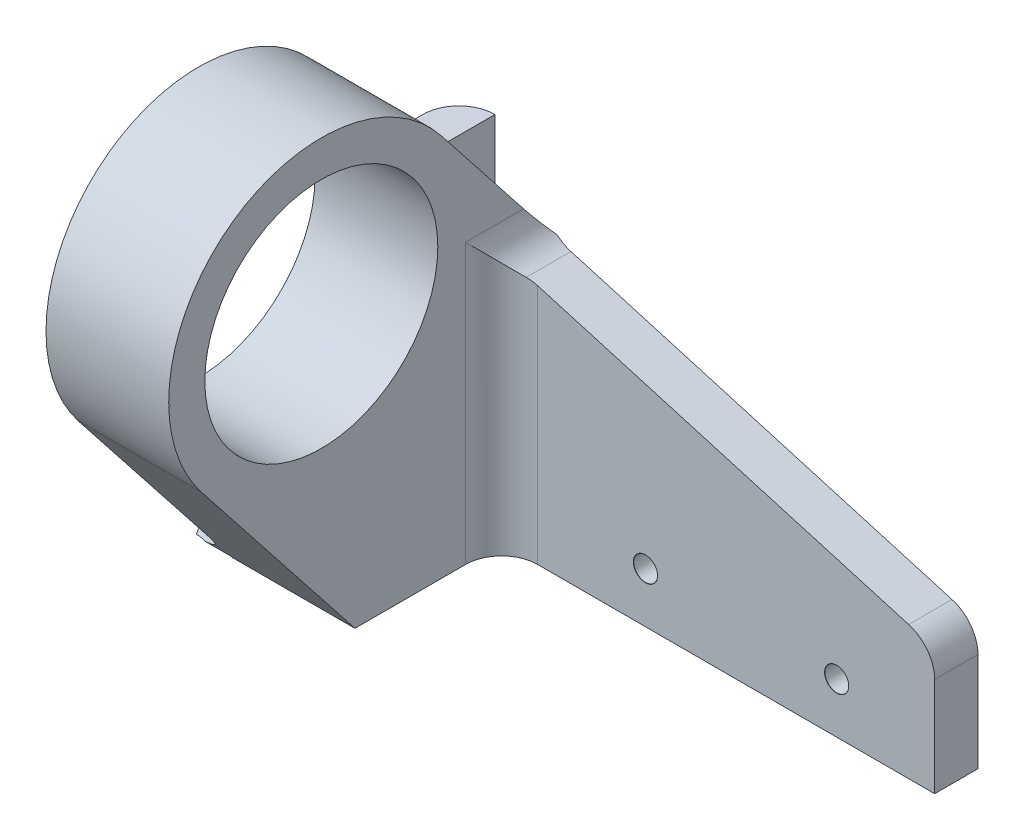
from build123d import *

# Parameters (mm, degrees)
SKETCH1_R                             = 21.14
SKETCH1_R_2                           = 16.14
BOSS_EXTRUDE1_DEPTH                   = 17
BOSS_EXTRUDE2_DEPTH                   = 17
SKETCH3_W                             = 6
SKETCH3_H                             = 34.909785338
BOSS_EXTRUDE3_DEPTH                   = 60
CUT_EXTRUDE1_DEPTH                    = 30
FILLET1_R                             = 5
BOSS_EXTRUDE4_DEPTH                   = 5
FILLET2_R                             = 5
TAP_DRILL_FOR_M4X0_7_TAP1_D           = 3.3
TAP_DRILL_FOR_M4X0_7_TAP1_DEPTH       = 5
TAP_DRILL_FOR_M4X0_7_TAP1_CSINK_D     = 3.35
TAP_DRILL_FOR_M4X0_7_TAP1_CSINK_ANGLE = 100
TAP_DRILL_FOR_M4X0_7_TAP1_TIP         = 0.991420021
TAP_DRILL_FOR_M4X0_7_TAP2_D           = 3.3
TAP_DRILL_FOR_M4X0_7_TAP2_DEPTH       = 7
TAP_DRILL_FOR_M4X0_7_TAP2_CSINK_D     = 3.35
TAP_DRILL_FOR_M4X0_7_TAP2_CSINK_ANGLE = 100
TAP_DRILL_FOR_M4X0_7_TAP2_TIP         = 0.991420021


with BuildPart() as part:
    # Sketch1 → Boss-Extrude1 (new body)
    with BuildSketch(Plane(origin=(0, 0, 0), x_dir=(0, 0, -1), z_dir=(1, 0, 0))):
        Circle(SKETCH1_R)
        Circle(SKETCH1_R_2, mode=Mode.SUBTRACT)
    extrude(amount=BOSS_EXTRUDE1_DEPTH)

    # Sketch2 → Boss-Extrude2 (add)
    with BuildSketch(Plane.ZY):
        with BuildLine():
            Line((-30.978599342, -40.052160935), (-30.978599342, -5.142375597))
            Line((-30.978599342, -5.142375597), (-16.599116733, 13.09079538))
            ThreePointArc((-16.599116733, 13.09079538), (-13.09079538, -16.599116733), (16.599116733, -13.09079538))
            Line((16.599116733, -13.09079538), (-4.663804983, -40.052160935))
            Line((-4.663804983, -40.052160935), (-30.978599342, -40.052160935))
        make_face()
    extrude(amount=-BOSS_EXTRUDE2_DEPTH)

    # Sketch3 → Boss-Extrude3 (add)
    with BuildSketch(Plane(origin=(17, 0, 0), x_dir=(0, 0, -1), z_dir=(1, 0, 0))):
        with Locations((27.978599342, -22.597268266)):
            Rectangle(SKETCH3_W, SKETCH3_H)
    extrude(amount=BOSS_EXTRUDE3_DEPTH)

    # Sketch4 → Cut-Extrude1 (cut)
    with BuildSketch(Plane.XY.offset(-24.978599342)):
        Polygon((17, -5.142375597), (77, -22.597268266), (77, -5.142375597), align=None)
    extrude(amount=-CUT_EXTRUDE1_DEPTH, mode=Mode.SUBTRACT)

    # Fillet1
    fillet1_edges = [part.edges().sort_by_distance(p)[0] for p in [
        (17, -5.142375597, -27.978599342),
        (17, -22.597268266, -24.978599342),
        (77, -22.597268266, -27.978599342),
    ]]
    fillet(fillet1_edges, radius=FILLET1_R)

    # Sketch5 → Boss-Extrude4 (add)
    with BuildSketch(Plane.ZY):
        Polygon((-30.978599342, -5.098400642), (-41.06651396, -5.098400642), (-41.06651396, -39.736841718), (-25.501919328, -39.736841718), (-4.663804983, -39.736841718), align=None)
    extrude(amount=BOSS_EXTRUDE4_DEPTH)

    # Fillet2
    # the kernel refuses this fillet: 5 mm, written as the material it adds along each edge
    with BuildSketch(Plane(origin=(0, -49.690311531, 2.897837608), x_dir=(0, 0.604931407257239, 0.7962775850881252), z_dir=(0, 0.7962775850881253, -0.604931407257239))) as fillet2_piece_1_section:
        with BuildLine():
            CenterArc((FILLET2_R, -FILLET2_R), FILLET2_R, 90, 90)
            Line((0, -FILLET2_R), (0, 0))
            Line((0, 0), (FILLET2_R, 0))
        make_face()
    fillet2_piece_1 = extrude(amount=68.472330766, mode=Mode.PRIVATE)
    fillet2_piece_1 = split(fillet2_piece_1, bisect_by=Plane(origin=(-1.128828845, -8.634761076, -33.732848524), z_dir=(0, -0.6192429224168574, 0.7851994670379179)), keep=Keep.TOP, mode=Mode.PRIVATE)
    fillet2_piece_1 = split(fillet2_piece_1, bisect_by=Plane(origin=(-1.128828845, -34.816351836, -0.534615058), z_dir=(0, 0.6192429224168575, -0.7851994670379177)), keep=Keep.TOP, mode=Mode.PRIVATE)
    fillet2_piece_1 = split(fillet2_piece_1, bisect_by=Plane(origin=(-1.128828845, -39.736841718, -16.726060425), z_dir=(0, 1, 0)), keep=Keep.TOP, mode=Mode.PRIVATE)
    add(fillet2_piece_1)
    # the kernel refuses this fillet: 5 mm, written as the material it takes off along each edge
    with BuildSketch(Plane(origin=(-5, 7.401599358, -41.06651396), x_dir=(0, 0, 1), z_dir=(0, -1, 0))) as fillet2_2_piece_1:
        with BuildLine():
            CenterArc((FILLET2_R, -FILLET2_R), FILLET2_R, 90, 90)
            Line((0, -FILLET2_R), (0, 0))
            Line((0, 0), (FILLET2_R, 0))
        make_face()
    extrude(amount=59.638441075, mode=Mode.SUBTRACT)

    # Tap Drill for M4x0.7 Tap1
    with Locations(Plane.ZY.offset(5)):
        with Locations((-35.156261267, -14.70127854), (-35.156261267, -34.106690994)):
            CounterSinkHole(TAP_DRILL_FOR_M4X0_7_TAP1_D / 2, TAP_DRILL_FOR_M4X0_7_TAP1_CSINK_D / 2, depth=TAP_DRILL_FOR_M4X0_7_TAP1_DEPTH, counter_sink_angle=TAP_DRILL_FOR_M4X0_7_TAP1_CSINK_ANGLE)
            with Locations((0, 0, -(TAP_DRILL_FOR_M4X0_7_TAP1_DEPTH + TAP_DRILL_FOR_M4X0_7_TAP1_TIP / 2))):  # 118° drill point
                Cone(0, TAP_DRILL_FOR_M4X0_7_TAP1_D / 2, TAP_DRILL_FOR_M4X0_7_TAP1_TIP, mode=Mode.SUBTRACT)

    # Tap Drill for M4x0.7 Tap2
    with Locations(Plane.XY.offset(-24.978599342)):
        with Locations((36.93257039, -33.095127913), (63.418354043, -33.095127913)):
            CounterSinkHole(TAP_DRILL_FOR_M4X0_7_TAP2_D / 2, TAP_DRILL_FOR_M4X0_7_TAP2_CSINK_D / 2, depth=TAP_DRILL_FOR_M4X0_7_TAP2_DEPTH, counter_sink_angle=TAP_DRILL_FOR_M4X0_7_TAP2_CSINK_ANGLE)
            with Locations((0, 0, -(TAP_DRILL_FOR_M4X0_7_TAP2_DEPTH + TAP_DRILL_FOR_M4X0_7_TAP2_TIP / 2))):  # 118° drill point
                Cone(0, TAP_DRILL_FOR_M4X0_7_TAP2_D / 2, TAP_DRILL_FOR_M4X0_7_TAP2_TIP, mode=Mode.SUBTRACT)


solid = part.part
